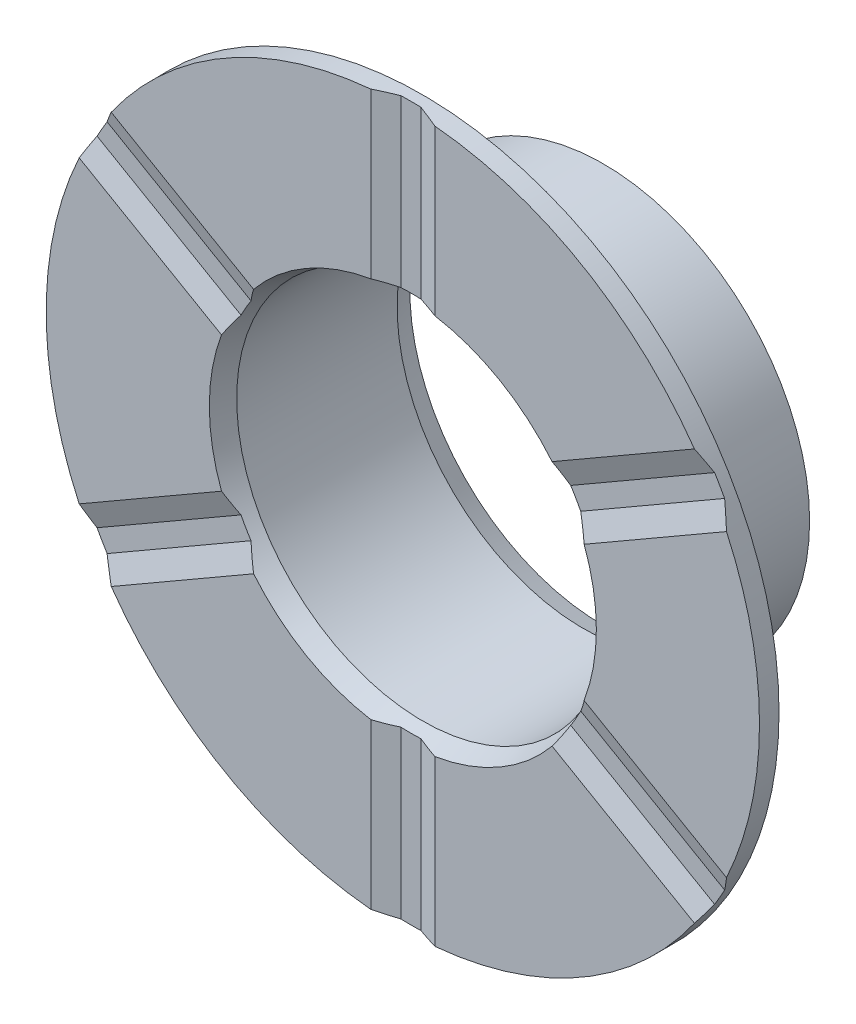
from build123d import *
from OCP.BRepFilletAPI import BRepFilletAPI_MakeChamfer

# Parameters (mm, degrees)
SKETCH1_R                      = 20.575
SKETCH1_R_2                    = 18.575
BOSS_EXTRUDE1_DEPTH            = 20
BOSS_EXTRUDE2_START            = -1.95
SKETCH2_R                      = 35.575
SKETCH2_R_2                    = 20.575
BOSS_EXTRUDE2_DEPTH            = 1.95
CHAMFER2_SIZE                  = 2
CHAMFER2_SIZE2                 = 0.727940469
SKETCH3_W                      = 2
SKETCH3_H                      = 18
CUT_EXTRUDE1_DEPTH             = 0.8
CHAMFER3_SIZE                  = 2.197981936
CHAMFER3_SIZE_2                = 0.8
CIRPATTERN2_COUNT              = 6
CHAMFER3_OF_CIRPATTERN2_SIZE   = 2.197981936
CHAMFER3_OF_CIRPATTERN2_SIZE_2 = 0.8


with BuildPart() as part:
    # Sketch1 → Boss-Extrude1 (new body)
    with BuildSketch(Plane.XY):
        Circle(SKETCH1_R)
        Circle(SKETCH1_R_2, mode=Mode.SUBTRACT)
    extrude(amount=BOSS_EXTRUDE1_DEPTH)

    # Sketch2 → Boss-Extrude2 (add)
    with BuildSketch(Plane.XY.offset(20).offset(BOSS_EXTRUDE2_START)):
        Circle(SKETCH2_R)
        Circle(SKETCH2_R_2, mode=Mode.SUBTRACT)
    extrude(amount=BOSS_EXTRUDE2_DEPTH)

    # Chamfer2
    chamfer2_edges = [part.edges().sort_by_distance(p)[0] for p in [
        (-18.575, 0, 0),
        (-18.575, 0, 20),
    ]]
    chamfer2_side = [part.faces().sort_by_distance(p)[0] for p in [
        (-18.575, 0, 10),
    ]]
    chamfer(chamfer2_edges, length=CHAMFER2_SIZE, length2=CHAMFER2_SIZE2, reference=chamfer2_side[0])

    # Sketch3 → Cut-Extrude1 (cut)
    with BuildSketch(Plane.XY.offset(20)):
        with Locations((0, 27.575)):
            Rectangle(SKETCH3_W, SKETCH3_H)
    cut_extrude1 = extrude(amount=-CUT_EXTRUDE1_DEPTH, mode=Mode.SUBTRACT)

    # Chamfer3
    chamfer3_edges_1 = [part.edges().sort_by_distance(p)[0] for p in [
        (1, 27.418981343, 20),
    ]]
    chamfer3_side_1 = [part.faces().sort_by_distance(p)[0] for p in [
        (1.016, 27.418981343, 20),
    ]]
    chamfer3_edges_2 = [part.edges().sort_by_distance(p)[0] for p in [
        (-1, 27.418981343, 20),
    ]]
    chamfer3_side_2 = [part.faces().sort_by_distance(p)[0] for p in [
        (-1.016, 27.418981343, 20),
    ]]
    chamfer3 = BRepFilletAPI_MakeChamfer(part.part.solid().wrapped)
    for e in chamfer3_edges_1:
        chamfer3.Add(CHAMFER3_SIZE - 0.0001, CHAMFER3_SIZE_2 - 0.0001, e.wrapped, chamfer3_side_1[0].wrapped)
    for e in chamfer3_edges_2:
        chamfer3.Add(CHAMFER3_SIZE - 0.0001, CHAMFER3_SIZE_2 - 0.0001, e.wrapped, chamfer3_side_2[0].wrapped)
    add(Compound.cast(chamfer3.Shape()), mode=Mode.REPLACE)  # a hair under: the kernel refuses the full size

    # CirPattern2: Cut-Extrude1 ×6 about axis
    cirpattern2_axis = Axis((0, 0, 0), (0, 0, 1))
    for i in range(1, CIRPATTERN2_COUNT):
        add(cut_extrude1.rotate(cirpattern2_axis, i * 360 / CIRPATTERN2_COUNT), mode=Mode.SUBTRACT)

    # Chamfer3 of CirPattern2
    chamfer3_of_cirpattern2_edges_1 = [part.edges().sort_by_distance(p)[0] for p in [
        (-23.245534389, 14.575516075, 20),
    ]]
    chamfer3_of_cirpattern2_side_1 = [part.faces().sort_by_distance(p)[0] for p in [
        (-23.237534389, 14.589372482, 20),
    ]]
    chamfer3_of_cirpattern2_edges_2 = [part.edges().sort_by_distance(p)[0] for p in [
        (-24.245534389, 12.843465267, 20),
    ]]
    chamfer3_of_cirpattern2_side_2 = [part.faces().sort_by_distance(p)[0] for p in [
        (-24.245534389, 12.843465267, 19.984),
    ]]
    chamfer3_of_cirpattern2_edges_3 = [part.edges().sort_by_distance(p)[0] for p in [
        (-24.245534389, -12.843465267, 20),
    ]]
    chamfer3_of_cirpattern2_side_3 = [part.faces().sort_by_distance(p)[0] for p in [
        (-24.253534389, -12.829608861, 20),
    ]]
    chamfer3_of_cirpattern2_edges_4 = [part.edges().sort_by_distance(p)[0] for p in [
        (-23.245534389, -14.575516075, 20),
    ]]
    chamfer3_of_cirpattern2_side_4 = [part.faces().sort_by_distance(p)[0] for p in [
        (-23.245534389, -14.575516075, 19.984),
    ]]
    chamfer3_of_cirpattern2_edges_5 = [part.edges().sort_by_distance(p)[0] for p in [
        (-1, -27.418981343, 20),
    ]]
    chamfer3_of_cirpattern2_side_5 = [part.faces().sort_by_distance(p)[0] for p in [
        (-1.016, -27.418981343, 20),
    ]]
    chamfer3_of_cirpattern2_edges_6 = [part.edges().sort_by_distance(p)[0] for p in [
        (1, -27.418981343, 20),
    ]]
    chamfer3_of_cirpattern2_side_6 = [part.faces().sort_by_distance(p)[0] for p in [
        (1, -27.418981343, 19.984),
    ]]
    chamfer3_of_cirpattern2_edges_7 = [part.edges().sort_by_distance(p)[0] for p in [
        (23.245534389, -14.575516075, 20),
    ]]
    chamfer3_of_cirpattern2_side_7 = [part.faces().sort_by_distance(p)[0] for p in [
        (23.237534389, -14.589372482, 20),
    ]]
    chamfer3_of_cirpattern2_edges_8 = [part.edges().sort_by_distance(p)[0] for p in [
        (24.245534389, -12.843465267, 20),
    ]]
    chamfer3_of_cirpattern2_side_8 = [part.faces().sort_by_distance(p)[0] for p in [
        (24.245534389, -12.843465267, 19.984),
    ]]
    chamfer3_of_cirpattern2_edges_9 = [part.edges().sort_by_distance(p)[0] for p in [
        (24.245534389, 12.843465267, 20),
    ]]
    chamfer3_of_cirpattern2_side_9 = [part.faces().sort_by_distance(p)[0] for p in [
        (24.253534389, 12.829608861, 20),
    ]]
    chamfer3_of_cirpattern2_edges_10 = [part.edges().sort_by_distance(p)[0] for p in [
        (23.245534389, 14.575516075, 20),
    ]]
    chamfer3_of_cirpattern2_side_10 = [part.faces().sort_by_distance(p)[0] for p in [
        (23.245534389, 14.575516075, 19.984),
    ]]
    chamfer3_of_cirpattern2 = BRepFilletAPI_MakeChamfer(part.part.solid().wrapped)
    for e in chamfer3_of_cirpattern2_edges_1:
        chamfer3_of_cirpattern2.Add(CHAMFER3_OF_CIRPATTERN2_SIZE - 0.0001, CHAMFER3_OF_CIRPATTERN2_SIZE_2 - 0.0001, e.wrapped, chamfer3_of_cirpattern2_side_1[0].wrapped)
    for e in chamfer3_of_cirpattern2_edges_2:
        chamfer3_of_cirpattern2.Add(CHAMFER3_OF_CIRPATTERN2_SIZE_2 - 0.0001, CHAMFER3_OF_CIRPATTERN2_SIZE - 0.0001, e.wrapped, chamfer3_of_cirpattern2_side_2[0].wrapped)
    for e in chamfer3_of_cirpattern2_edges_3:
        chamfer3_of_cirpattern2.Add(CHAMFER3_OF_CIRPATTERN2_SIZE - 0.0001, CHAMFER3_OF_CIRPATTERN2_SIZE_2 - 0.0001, e.wrapped, chamfer3_of_cirpattern2_side_3[0].wrapped)
    for e in chamfer3_of_cirpattern2_edges_4:
        chamfer3_of_cirpattern2.Add(CHAMFER3_OF_CIRPATTERN2_SIZE_2 - 0.0001, CHAMFER3_OF_CIRPATTERN2_SIZE - 0.0001, e.wrapped, chamfer3_of_cirpattern2_side_4[0].wrapped)
    for e in chamfer3_of_cirpattern2_edges_5:
        chamfer3_of_cirpattern2.Add(CHAMFER3_OF_CIRPATTERN2_SIZE - 0.0001, CHAMFER3_OF_CIRPATTERN2_SIZE_2 - 0.0001, e.wrapped, chamfer3_of_cirpattern2_side_5[0].wrapped)
    for e in chamfer3_of_cirpattern2_edges_6:
        chamfer3_of_cirpattern2.Add(CHAMFER3_OF_CIRPATTERN2_SIZE_2 - 0.0001, CHAMFER3_OF_CIRPATTERN2_SIZE - 0.0001, e.wrapped, chamfer3_of_cirpattern2_side_6[0].wrapped)
    for e in chamfer3_of_cirpattern2_edges_7:
        chamfer3_of_cirpattern2.Add(CHAMFER3_OF_CIRPATTERN2_SIZE - 0.0001, CHAMFER3_OF_CIRPATTERN2_SIZE_2 - 0.0001, e.wrapped, chamfer3_of_cirpattern2_side_7[0].wrapped)
    for e in chamfer3_of_cirpattern2_edges_8:
        chamfer3_of_cirpattern2.Add(CHAMFER3_OF_CIRPATTERN2_SIZE_2 - 0.0001, CHAMFER3_OF_CIRPATTERN2_SIZE - 0.0001, e.wrapped, chamfer3_of_cirpattern2_side_8[0].wrapped)
    for e in chamfer3_of_cirpattern2_edges_9:
        chamfer3_of_cirpattern2.Add(CHAMFER3_OF_CIRPATTERN2_SIZE - 0.0001, CHAMFER3_OF_CIRPATTERN2_SIZE_2 - 0.0001, e.wrapped, chamfer3_of_cirpattern2_side_9[0].wrapped)
    for e in chamfer3_of_cirpattern2_edges_10:
        chamfer3_of_cirpattern2.Add(CHAMFER3_OF_CIRPATTERN2_SIZE_2 - 0.0001, CHAMFER3_OF_CIRPATTERN2_SIZE - 0.0001, e.wrapped, chamfer3_of_cirpattern2_side_10[0].wrapped)
    add(Compound.cast(chamfer3_of_cirpattern2.Shape()), mode=Mode.REPLACE)  # a hair under: the kernel refuses the full size


solid = part.part
